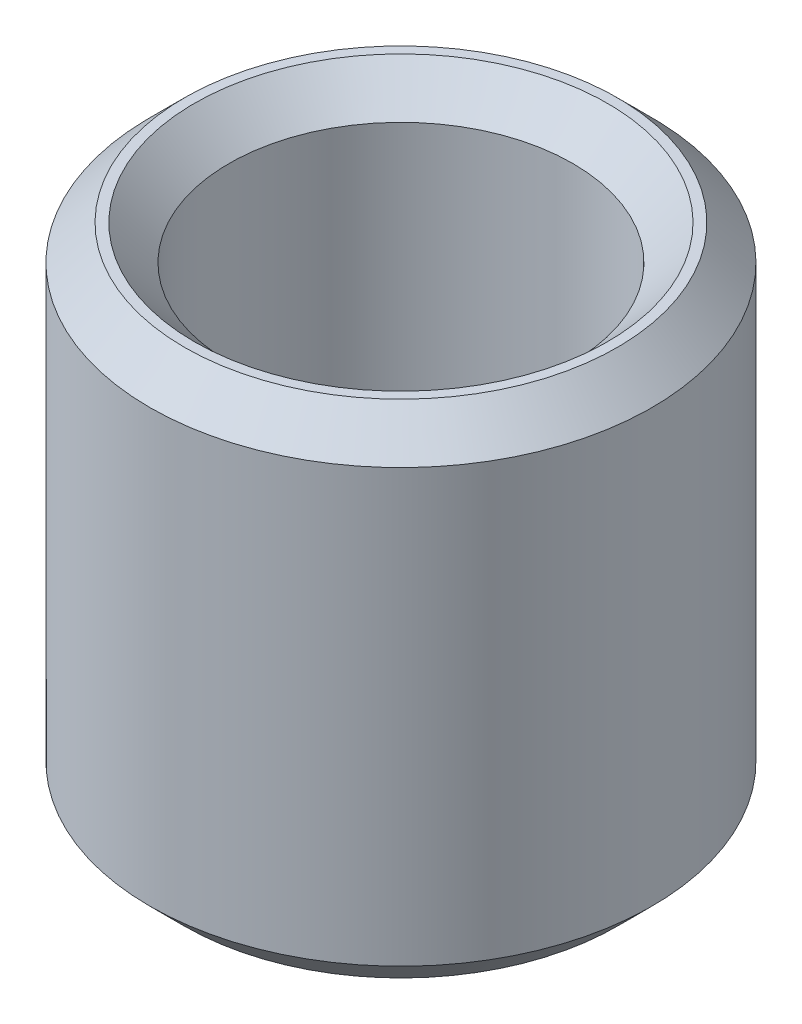
from build123d import *

# Parameters (mm, degrees)
SKETCH1_R           = 25
BOSS_EXTRUDE1_DEPTH = 49.919319711
SKETCH2_R           = 17.113566873
CUT_EXTRUDE1_DEPTH  = 62.171386124
CHAMFER1_SIZE       = 3.45639388


with BuildPart() as part:
    # Sketch1 → Boss-Extrude1 (new body)
    with BuildSketch(Plane(origin=(0, 0, 0), x_dir=(1, 0, 0), z_dir=(0, 1, 0))):
        Circle(SKETCH1_R)
    extrude(amount=BOSS_EXTRUDE1_DEPTH)

    # Sketch2 → Cut-Extrude1 (cut, through all)
    with BuildSketch(Plane(origin=(0, 0, 0), x_dir=(1, 0, 0), z_dir=(0, 1, 0))):
        Circle(SKETCH2_R)
    extrude(amount=CUT_EXTRUDE1_DEPTH, mode=Mode.SUBTRACT)

    # Chamfer1
    chamfer1_edges = [part.edges().sort_by_distance(p)[0] for p in [
        (-17.113566873, 49.919319711, 0),
        (-17.113566873, 0, 0),
        (-25, 0, 0),
        (-25, 49.919319711, 0),
    ]]
    chamfer(chamfer1_edges, length=CHAMFER1_SIZE)


solid = part.part
